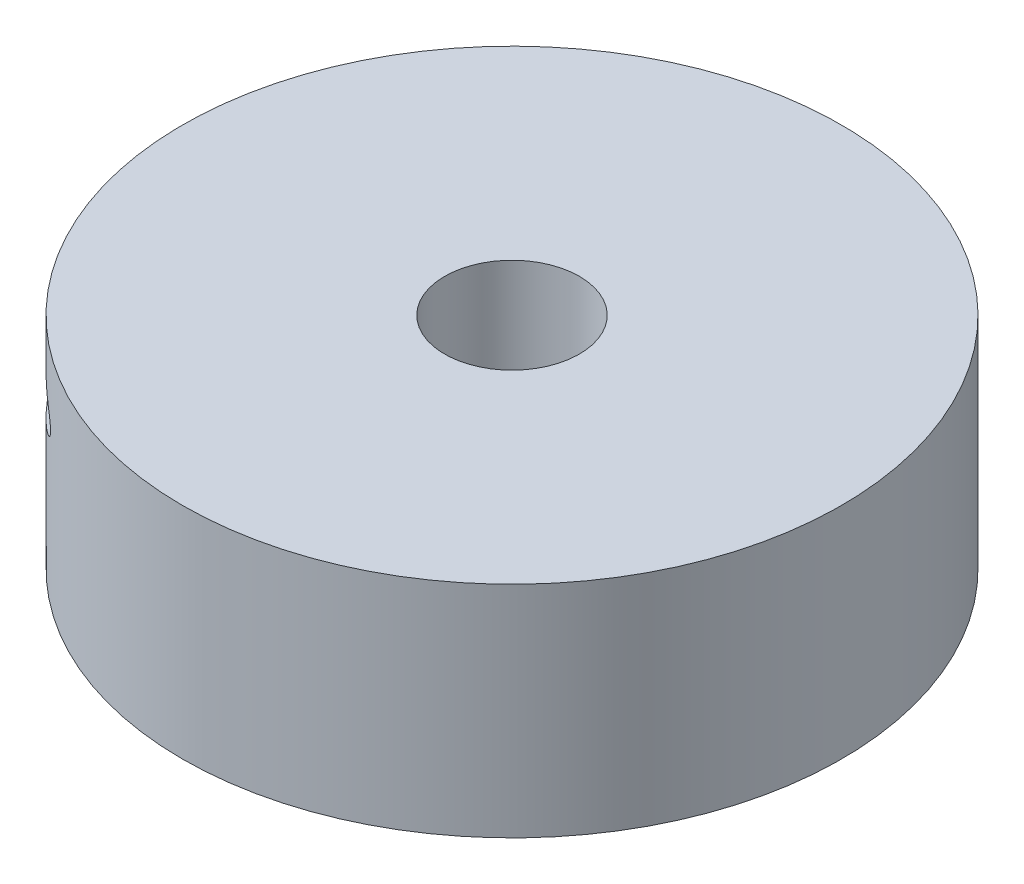
from build123d import *

# Parameters (mm, degrees)
SKETCH2_R           = 28.575
SKETCH2_R_2         = 5.842
BOSS_EXTRUDE1_DEPTH = 19.05
SKETCH3_R           = 2.3495
CUT_EXTRUDE1_DEPTH  = 206.284566432


with BuildPart() as part:
    # Sketch2 → Boss-Extrude1 (new body)
    with BuildSketch(Plane(origin=(0, 0, 0), x_dir=(1, 0, 0), z_dir=(0, 1, 0))):
        Circle(SKETCH2_R)
        Circle(SKETCH2_R_2, mode=Mode.SUBTRACT)
    extrude(amount=BOSS_EXTRUDE1_DEPTH)

    # Sketch3 → Cut-Extrude1 (cut, through all)
    with BuildSketch(Plane(origin=(-19.036493345, 184.623848898, -47.51004015), x_dir=(-0.7851291614483605, 0.0006136742891857283, 0.6193317554003356), z_dir=(-0.6190324269520984, -0.03188005298701783, -0.7847181128299129))):
        with Locations((44.353535624, -173.175566882)):
            Circle(SKETCH3_R)
        with Locations((46.68181957, 8.1642617)):
            Circle(SKETCH3_R)
    extrude(amount=-CUT_EXTRUDE1_DEPTH, mode=Mode.SUBTRACT)


solid = part.part
